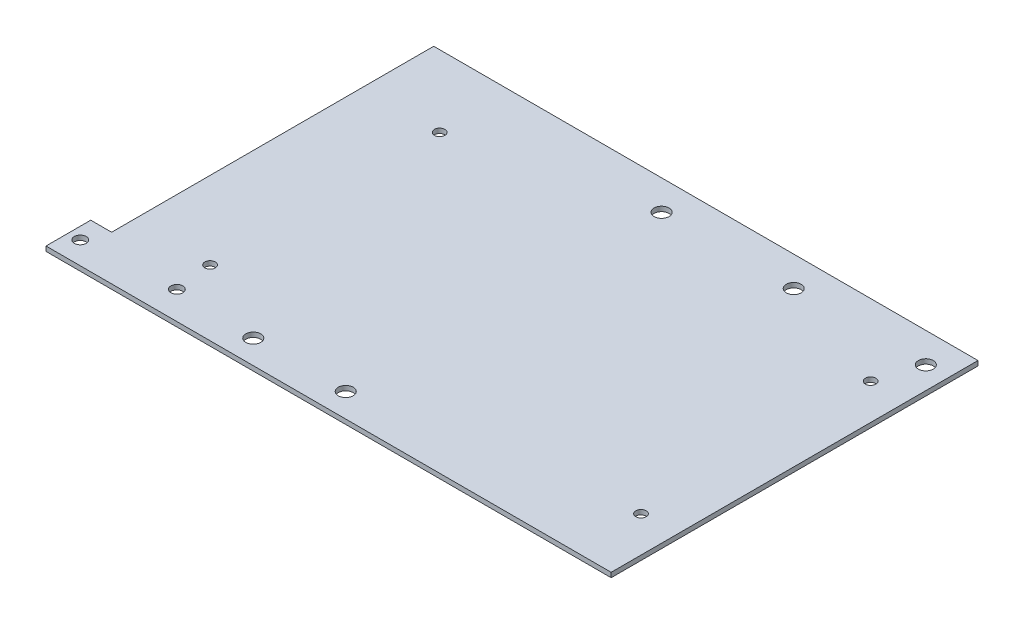
from build123d import *

# Parameters (mm, degrees)
SKETCH1_R           = 4
SKETCH1_R_2         = 3.5
SKETCH1_R_3         = 5
BOSS_EXTRUDE1_DEPTH = 3.17


with BuildPart() as part:
    # Sketch1 → Boss-Extrude1 (new body)
    with BuildSketch(Plane(origin=(0, 0, 0), x_dir=(1, 0, 0), z_dir=(0, 1, 0))):
        Polygon((1.713446604, -2.5), (366.713446604, -2.5), (366.713446604, -248.5), (-12.286553396, -248.5), (-12.286553396, -218.5), (1.713446604, -218.5), align=None)
        with Locations(Location((-4.333354101, -233.5, 0), (0, 0, 270))):
            Circle(SKETCH1_R, mode=Mode.SUBTRACT)
        with Locations(Location((56.754069102, -229.789646053, 0), (0, 0, 270))):
            Circle(SKETCH1_R, mode=Mode.SUBTRACT)
        with Locations(Location((53.713446604, -50.5, 0), (0, 0, 270))):
            Circle(SKETCH1_R_2, mode=Mode.SUBTRACT)
        with Locations(Location((53.713446604, -204.5, 0), (0, 0, 270))):
            Circle(SKETCH1_R_2, mode=Mode.SUBTRACT)
        with Locations(Location((342.713446604, -204.5, 0), (0, 0, 270))):
            Circle(SKETCH1_R_2, mode=Mode.SUBTRACT)
        with Locations(Location((342.713446604, -50.5, 0), (0, 0, 270))):
            Circle(SKETCH1_R_2, mode=Mode.SUBTRACT)
        with Locations(Location((263.133334245, -22.5, 0), (0, 0, 270))):
            Circle(SKETCH1_R_3, mode=Mode.SUBTRACT)
        with Locations(Location((172.713446604, -232.5, 0), (0, 0, 270))):
            Circle(SKETCH1_R_3, mode=Mode.SUBTRACT)
        with Locations(Location((110.713446604, -232.5, 0), (0, 0, 270))):
            Circle(SKETCH1_R_3, mode=Mode.SUBTRACT)
        with Locations(Location((174.553221886, -22.5, 0), (0, 0, 270))):
            Circle(SKETCH1_R_3, mode=Mode.SUBTRACT)
        with Locations(Location((351.713446604, -22.5, 0), (0, 0, 270))):
            Circle(SKETCH1_R_3, mode=Mode.SUBTRACT)
    extrude(amount=-BOSS_EXTRUDE1_DEPTH)


solid = part.part
